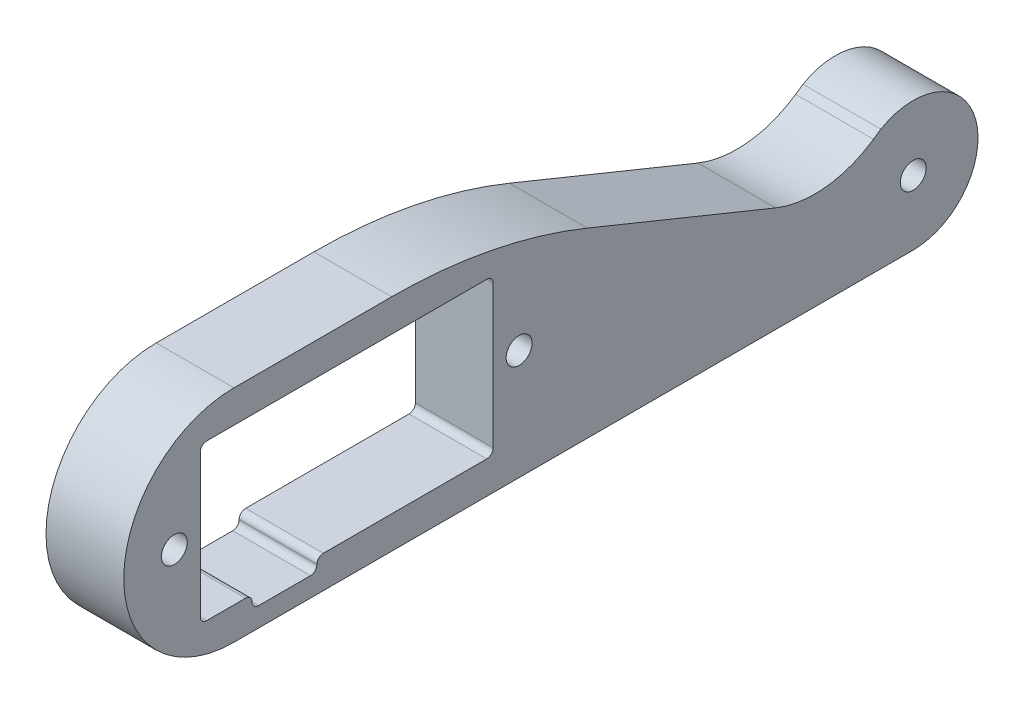
from build123d import *

# Parameters (mm, degrees)
SCHIZZO1_R                   = 1
ESTRUSIONE_ESTRUSIONE1_DEPTH = 6
RACCORDO1_R                  = 8
RACCORDO2_R                  = 40
RACCORDO3_R                  = 0.5


with BuildPart() as part:
    # Schizzo1 → Estrusione-Estrusione1 (new body)
    with BuildSketch(Plane(origin=(0, 0, 0), x_dir=(0, 0, -1), z_dir=(1, 0, 0))):
        with BuildLine():
            Line((22.6, 14.5), (2.6, 14.5))
            ThreePointArc((2.6, 14.5), (-5.9, 6), (2.6, -2.5))
            Line((2.6, -2.5), (55, -2.5))
            ThreePointArc((55, -2.5), (59.829629131, 3.794095226), (52.5, 6.830127019))
            Line((52.5, 6.830127019), (48.378061008, 4))
            Line((48.378061008, 4), (22.6, 14.5))
        make_face()
        Polygon((0, 0), (0, 12), (22.6, 12), (22.6, 0), (9, 0), (9, -1), (4, -1), (4, 0), align=None, mode=Mode.SUBTRACT)
        with Locations((-2, 6)):
            Circle(SCHIZZO1_R, mode=Mode.SUBTRACT)
        with Locations((24.6, 6)):
            Circle(SCHIZZO1_R, mode=Mode.SUBTRACT)
        with Locations((55, 2.5)):
            Circle(SCHIZZO1_R, mode=Mode.SUBTRACT)
    extrude(amount=ESTRUSIONE_ESTRUSIONE1_DEPTH)

    # Raccordo1
    raccordo1_edges = [part.edges().sort_by_distance(p)[0] for p in [
        (3, 4, -48.378061008),
    ]]
    fillet(raccordo1_edges, radius=RACCORDO1_R)

    # Raccordo2
    raccordo2_edges = [part.edges().sort_by_distance(p)[0] for p in [
        (3, 14.5, -22.6),
    ]]
    fillet(raccordo2_edges, radius=RACCORDO2_R)

    # Raccordo3
    raccordo3_edges = [part.edges().sort_by_distance(p)[0] for p in [
        (3, 0, -22.6),
        (3, 0, 0),
        (3, 12, 0),
        (3, 12, -22.6),
        (3, 0, -4),
        (3, -1, -4),
        (3, -1, -9),
        (3, 0, -9),
    ]]
    fillet(raccordo3_edges, radius=RACCORDO3_R - 0.0001)  # a hair under: the kernel refuses the full size


solid = part.part
